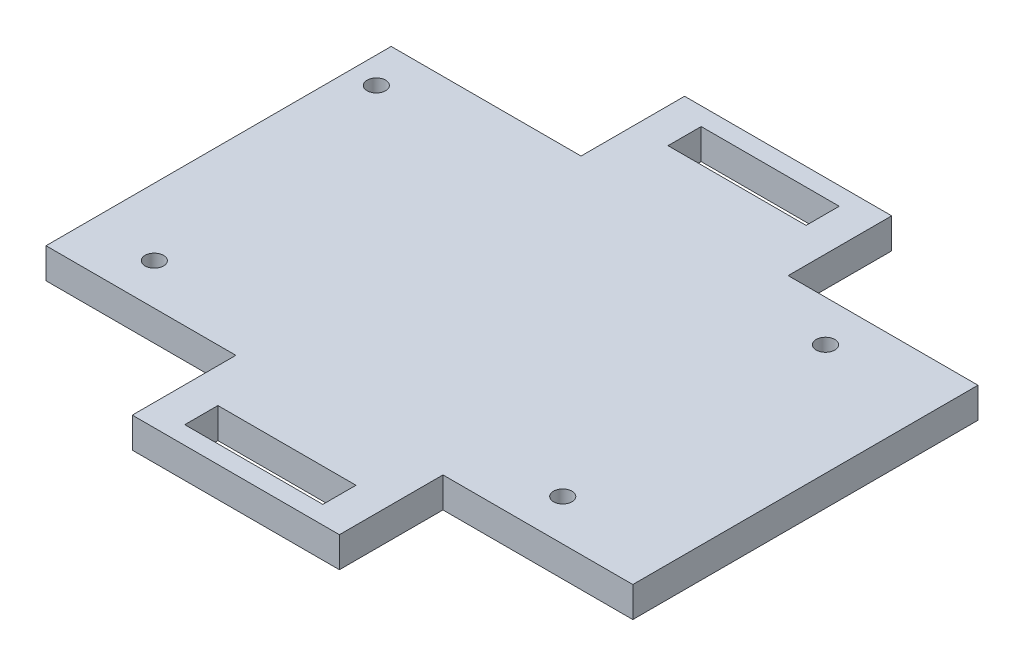
from build123d import *

# Parameters (mm, degrees)
BOSS_EXTRUDE1_DEPTH  = 5.588
SKETCH2_W            = 25.4
SKETCH2_H            = 6.096
CUT_EXTRUDE1_DEPTH   = 75.331462847
M3_CLEARANCE_HOLE1_D = 3.4


with BuildPart() as part:
    # Sketch1 → Boss-Extrude1 (new body)
    with BuildSketch(Plane(origin=(0, 0, 0), x_dir=(1, 0, 0), z_dir=(0, 1, 0))):
        Polygon((19.05, 31.75), (19.05, 50.8), (-19.05, 50.8), (-19.05, 31.75), (-53.975, 31.75), (-53.975, -31.75), (-19.05, -31.75), (-19.05, -50.8), (19.05, -50.8), (19.05, -31.75), (53.975, -31.75), (53.975, 31.75), align=None)
    extrude(amount=BOSS_EXTRUDE1_DEPTH)

    # Sketch2 → Cut-Extrude1 (cut, through all)
    with BuildSketch(Plane(origin=(0, 5.588, 0), x_dir=(1, 0, 0), z_dir=(0, 1, 0))):
        with Locations((0, 44.45)):
            Rectangle(SKETCH2_W, SKETCH2_H)
        with Locations((0, -44.45)):
            Rectangle(SKETCH2_W, SKETCH2_H)
    extrude(amount=-CUT_EXTRUDE1_DEPTH, mode=Mode.SUBTRACT)

    # M3 Clearance Hole1 (through all)
    with Locations(Plane(origin=(0, 5.588, 0), x_dir=(1, 0, 0), z_dir=(0, 1, 0))):
        with Locations((-49.1236, 24.1681), (33.5026, 24.1681), (33.5026, -24.1681), (-41.6306, -24.1681)):
            Hole(M3_CLEARANCE_HOLE1_D / 2)


solid = part.part
